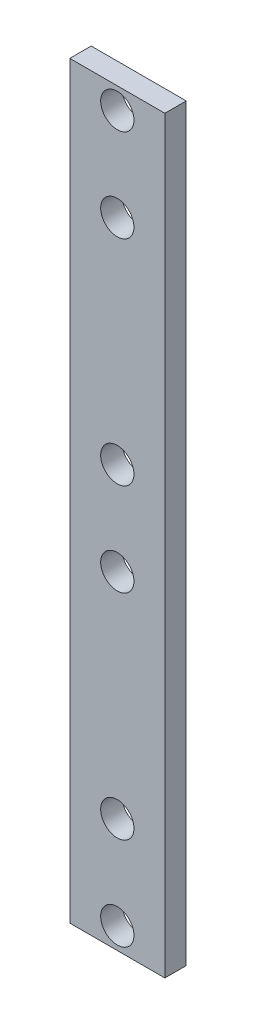
from build123d import *

# Parameters (mm, degrees)
SKETCH1_W           = 20
SKETCH1_H           = 157.5
BOSS_EXTRUDE1_DEPTH = 4.5
SKETCH2_R           = 3.5
CUT_EXTRUDE1_DEPTH  = 4.5


with BuildPart() as part:
    # Sketch1 → Boss-Extrude1 (new body)
    with BuildSketch(Plane.XY):
        with Locations((26.342010442, 2.25)):
            Rectangle(SKETCH1_W, SKETCH1_H)
    extrude(amount=BOSS_EXTRUDE1_DEPTH)

    # Sketch2 → Cut-Extrude1 (cut)
    with BuildSketch(Plane.XY.offset(4.5)):
        with Locations((26.342010442, -72)):
            Circle(SKETCH2_R)
        with Locations((26.342010442, -52.5)):
            Circle(SKETCH2_R)
        with Locations((26.342010442, -7.5)):
            Circle(SKETCH2_R)
        with Locations((26.342010442, 12)):
            Circle(SKETCH2_R)
        with Locations((26.342010442, 57)):
            Circle(SKETCH2_R)
        with Locations((26.342010442, 76.5)):
            Circle(SKETCH2_R)
    extrude(amount=-CUT_EXTRUDE1_DEPTH, mode=Mode.SUBTRACT)


solid = part.part
